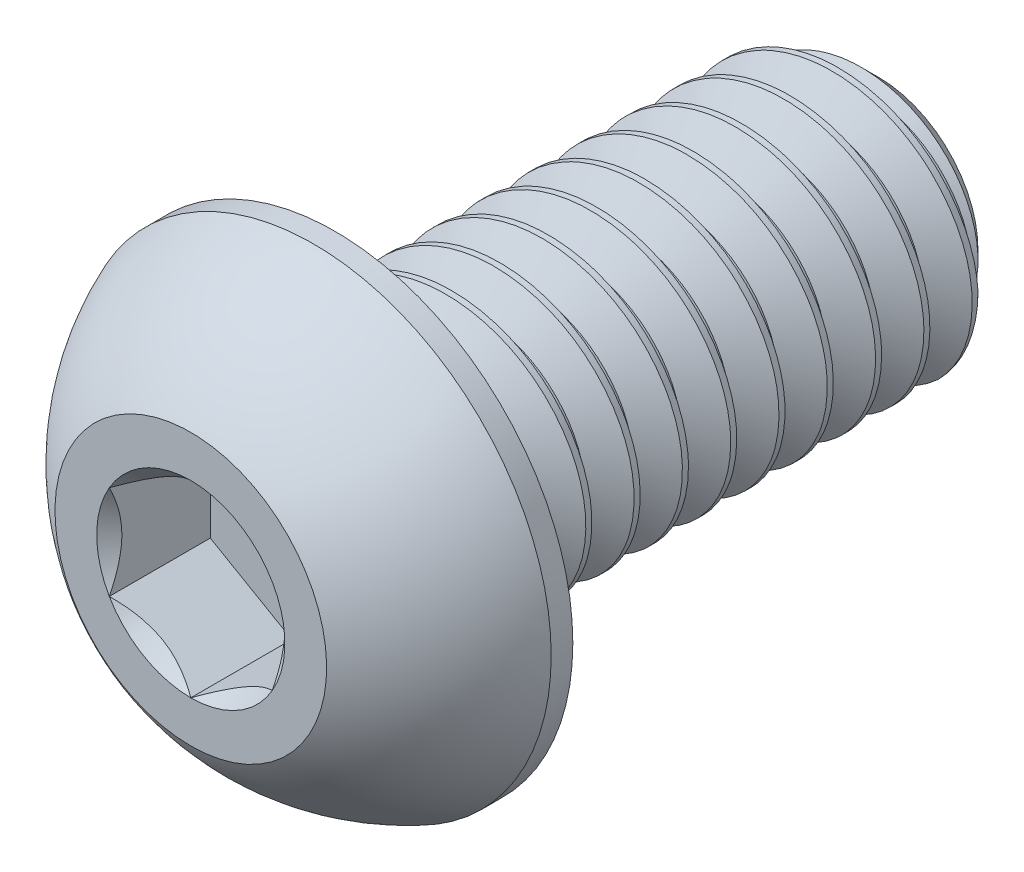
from build123d import *

# Parameters (mm, degrees)
SKETCH1_W          = 15.875
SKETCH1_H          = 3.96875
CHAMFER1_SIZE      = 1.058333333
CUT_SWEEP1_PITCH   = 1.411111111
CUT_EXTRUDE2_DEPTH = 2.95148


with BuildPart() as part:
    # Sketch1 → Revolve1 (revolve)
    with BuildSketch(Plane(origin=(0, 0, 0), x_dir=(0, 0, -1), z_dir=(1, 0, 0))):
        with Locations((12.1539, 1.984375)):
            Rectangle(SKETCH1_W, SKETCH1_H)
    revolve(axis=Axis((0, 0, -20.0914), (0, 0, 1)))

    # Chamfer1
    chamfer1_edges = [part.edges().sort_by_distance(p)[0] for p in [
        (0, -3.96875, -20.0914),
    ]]
    chamfer(chamfer1_edges, length=CHAMFER1_SIZE)

    # Cut-Sweep1: the profile of Sketch2 profile screwed along a right-hand helix of 12.25 turns, 8 arcs to a turn; built about Z, then put on its axis
    cut_sweep1_z = Axis((0, 0, 0), (0, 0, 1))
    cut_sweep1_corners = [(3.96905, 0, 0.000173205), (3.96905, 0, -1.234895427), (3.052206448, 0, -0.705555556), (3.052206448, 0, -0.529166667)]
    with BuildLine(mode=Mode.PRIVATE) as cut_sweep1_profile:
        Line(cut_sweep1_corners[0], cut_sweep1_corners[1])
        Line(cut_sweep1_corners[1], cut_sweep1_corners[2])
        Line(cut_sweep1_corners[2], cut_sweep1_corners[3])
        Line(cut_sweep1_corners[3], cut_sweep1_corners[0])
    cut_sweep1_cap = Face(cut_sweep1_profile.wire())
    cut_sweep1_turn_angles = [0, 22.5, 45, 67.5, 90, 112.5, 135, 157.5, 180, 202.5, 225, 247.5, 270, 292.5, 315, 337.5, 360]
    cut_sweep1_turn_weights = [1, 0.9238795325112867, 1, 0.9238795325112867, 1, 0.9238795325112867, 1, 0.9238795325112867, 1, 0.9238795325112867, 1, 0.9238795325112867, 1, 0.9238795325112867, 1, 0.9238795325112867, 1]
    cut_sweep1_turn_rails = [Edge.make_bspline([Vector(p[0], p[1], 0).rotate(cut_sweep1_z, cut_sweep1_turn_angles[k]) / cut_sweep1_turn_weights[k] + Vector(0, 0, p[2] + CUT_SWEEP1_PITCH * cut_sweep1_turn_angles[k] / 360) for k in range(17)], [0, 0, 0, 1, 1, 2, 2, 3, 3, 4, 4, 5, 5, 6, 6, 7, 7, 8, 8, 8], 2, cut_sweep1_turn_weights) for p in cut_sweep1_corners]
    cut_sweep1_turn_sides = [Face.make_surface_from_curves(cut_sweep1_turn_rails[p[0]], cut_sweep1_turn_rails[p[1]]) for p in [(0, 1), (1, 2), (2, 3), (3, 0)]]
    cut_sweep1_last_angles = [4320, 4342.5, 4365, 4387.5, 4410]
    cut_sweep1_last_weights = [1, 0.9238795325112867, 1, 0.9238795325112321, 1]
    cut_sweep1_last_rails = [Edge.make_bspline([Vector(p[0], p[1], 0).rotate(cut_sweep1_z, cut_sweep1_last_angles[k]) / cut_sweep1_last_weights[k] + Vector(0, 0, p[2] + CUT_SWEEP1_PITCH * cut_sweep1_last_angles[k] / 360) for k in range(5)], [0, 0, 0, 1, 1, 2, 2, 2], 2, cut_sweep1_last_weights) for p in cut_sweep1_corners]
    cut_sweep1_last_sides = [Face.make_surface_from_curves(cut_sweep1_last_rails[p[0]], cut_sweep1_last_rails[p[1]]) for p in [(0, 1), (1, 2), (2, 3), (3, 0)]]
    cut_sweep1 = Plane(origin=(0, 0, -20.0914), x_dir=(0, 1, 0), z_dir=(0, 0, 1)) * Solid(Shell([*[p.moved(Location((0, 0, CUT_SWEEP1_PITCH * i))) for i in range(12) for p in cut_sweep1_turn_sides], *cut_sweep1_last_sides, cut_sweep1_cap, cut_sweep1_cap.rotate(cut_sweep1_z, 4410).moved(Location((0, 0, CUT_SWEEP1_PITCH * 4410 / 360)))]))
    add(cut_sweep1, mode=Mode.SUBTRACT)

    # Sketch7 → Revolve2 (revolve)
    with BuildSketch(Plane(origin=(0, 0, 0), x_dir=(0, 0, -1), z_dir=(1, 0, 0)), mode=Mode.PRIVATE) as revolve2_sk:
        with BuildLine():
            Line((3.58394, 6.9469), (4.2164, 6.9469))
            Line((4.2164, 6.9469), (4.2164, 0))
            Line((4.2164, 0), (0, 0))
            Line((0, 0), (0, 3.96875))
            ThreePointArc((0, 3.96875), (1.553770936, 5.744476496), (3.58394, 6.9469))
        make_face()
    revolve(revolve2_sk.sketch.rotate(Axis((0, 0, 0), (0, 0, -1)), 189.052465709), axis=Axis((0, 0, 0), (0, 0, -1)))

    # Sketch5 → Cut-Extrude2 (cut)
    with BuildSketch(Plane.XY):
        Polygon((2.38125, -1.374815329), (2.38125, 1.374815329), (0, 2.749630657), (-2.38125, 1.374815329), (-2.38125, -1.374815329), (0, -2.749630657), align=None)
    extrude(amount=-CUT_EXTRUDE2_DEPTH, mode=Mode.SUBTRACT)

    # Cut-Extrude3 cone 1 section (through the dimple's axis) → Cut-Extrude3 (revolve, cut)
    with BuildSketch(Plane(origin=(0, 0, 0), x_dir=(0, -1, 0), z_dir=(1, 0, 0))):
        Polygon((0, 0), (2.749630657, 0), (0, 2.749630657), align=None)
    revolve(axis=Axis((0, 0, 0), (0, 0, -1)), mode=Mode.SUBTRACT)


solid = part.part
